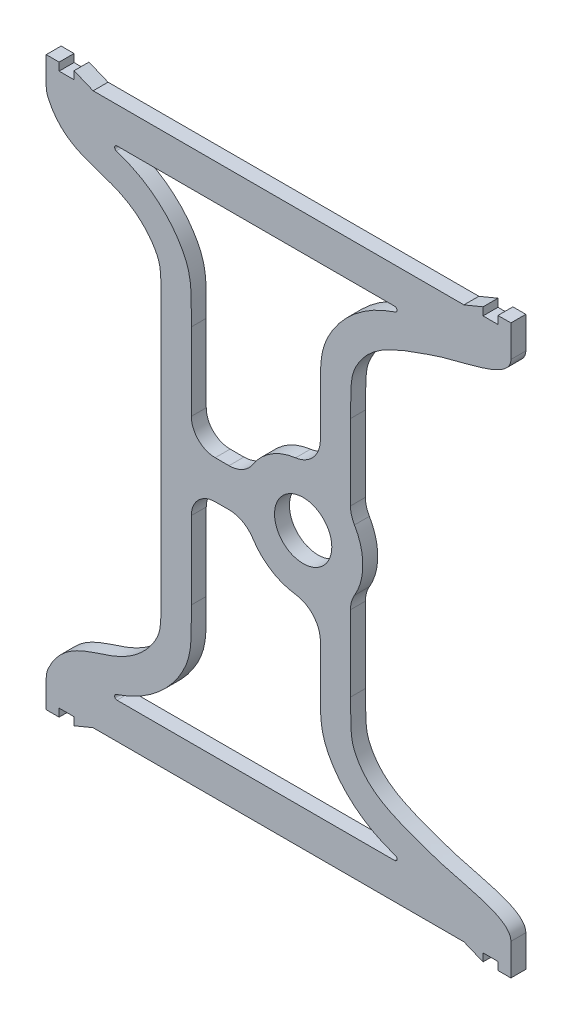
from build123d import *

# Parameters (mm, degrees)
SKETCH1_R           = 3.048
BOSS_EXTRUDE2_DEPTH = 1.5875
FILLET1_R           = 0.254
FILLET2_R           = 2.54


with BuildPart() as part:
    # Sketch1 → Boss-Extrude2 (new body)
    with BuildSketch(Plane.XY):
        with BuildLine():
            Line((-61.413118236, 56.1594), (-63.445118236, 56.995272298))
            Line((-63.445118236, 56.995272298), (-63.445118236, 56.1594))
            Line((-63.445118236, 56.1594), (-65.032618236, 56.1594))
            Line((-65.032618236, 56.1594), (-65.032618236, 56.995272298))
            Line((-65.032618236, 56.995272298), (-66.408583535, 56.995272298))
            Line((-66.408583535, 56.995272298), (-66.408583535, 53.6194))
            add(Edge.make_bspline(
                [(-66.408583535, 53.6194), (-64.924134504, 49.648429222), (-61.093412842, 49.418696243), (-56.357340235, 47.101597924), (-54.056381444, 44.067158287), (-54.218088214, 42.833714309), (-54.167482869, 39.645281186)],
                knots=[0, 0, 0, 0, 0.36456502, 0.416182118, 0.697050608, 1, 1, 1, 1], degree=3))
            Line((-54.167482869, 39.645281186), (-54.167482869, 13.974118814))
            add(Edge.make_bspline(
                [(-66.408583535, 0), (-64.924134504, 3.970970778), (-61.093412842, 4.200703757), (-56.357340235, 6.517802076), (-54.056381444, 9.552241713), (-54.218088214, 10.785685691), (-54.167482869, 13.974118814)],
                knots=[0, 0, 0, 0, 0.36456502, 0.416182118, 0.697050608, 1, 1, 1, 1], degree=3))
            Line((-66.408583535, 0), (-66.408583535, -3.375872298))
            Line((-66.408583535, -3.375872298), (-65.032618236, -3.375872298))
            Line((-65.032618236, -3.375872298), (-65.032618236, -2.54))
            Line((-65.032618236, -2.54), (-63.445118236, -2.54))
            Line((-63.445118236, -2.54), (-63.445118236, -3.375872298))
            Line((-63.445118236, -3.375872298), (-61.413118236, -2.54))
            Line((-61.413118236, -2.54), (-21.954933142, -2.54))
            Line((-21.954933142, -2.54), (-19.922933142, -3.375872298))
            Line((-19.922933142, -3.375872298), (-19.922933142, -2.54))
            Line((-19.922933142, -2.54), (-18.335433142, -2.54))
            Line((-18.335433142, -2.54), (-18.335433142, -3.375872298))
            Line((-18.335433142, -3.375872298), (-16.959467842, -3.375872298))
            Line((-16.959467842, -3.375872298), (-16.959467842, 0))
            add(Edge.make_bspline(
                [(-16.959467842, 0), (-16.958675299, 1.912546448), (-22.34771901, 2.746148332), (-27.970226959, 4.704128909), (-28.3324007, 4.840786662), (-32.040022312, 6.560590351), (-34.043884909, 9.535238573), (-33.977658838, 10.778235575), (-34.028382429, 13.974118814)],
                knots=[0, 0, 0, 0, 0.161069097, 0.19942284, 0.363080258, 0.414817965, 0.696342734, 1, 1, 1, 1], degree=3))
            Line((-34.028382429, 13.974118814), (-34.028382429, 22.02683367))
            ThreePointArc((-34.028382429, 22.02683367), (-33.920729589, 22.825528994), (-33.6054545, 23.567219611))
            ThreePointArc((-33.6054545, 23.567219611), (-32.7152, 26.8097), (-33.6054545, 30.052180389))
            ThreePointArc((-33.6054545, 30.052180389), (-33.920729589, 30.793871006), (-34.028382429, 31.59256633))
            Line((-34.028382429, 31.59256633), (-34.028382429, 39.645281186))
            add(Edge.make_bspline(
                [(-16.959467842, 53.6194), (-16.958675299, 51.706853552), (-22.34771901, 50.873251668), (-27.970226959, 48.915271091), (-28.3324007, 48.778613338), (-32.040022312, 47.058809649), (-34.043884909, 44.084161427), (-33.977658838, 42.841164425), (-34.028382429, 39.645281186)],
                knots=[0, 0, 0, 0, 0.161069097, 0.19942284, 0.363080258, 0.414817965, 0.696342734, 1, 1, 1, 1], degree=3))
            Line((-16.959467842, 53.6194), (-16.959467842, 56.995272298))
            Line((-16.959467842, 56.995272298), (-18.335433142, 56.995272298))
            Line((-18.335433142, 56.995272298), (-18.335433142, 56.1594))
            Line((-18.335433142, 56.1594), (-19.922933142, 56.1594))
            Line((-19.922933142, 56.1594), (-19.922933142, 56.995272298))
            Line((-19.922933142, 56.995272298), (-21.954933142, 56.1594))
            Line((-21.954933142, 56.1594), (-61.413118236, 56.1594))
        make_face()
        with BuildLine():
            Line((-27.775652978, 1.27), (-60.420212319, 1.27))
            add(Edge.make_bspline(
                [(-50.964190334, 13.995349312), (-50.966028907, 13.76903369), (-50.968736252, 13.297769798), (-50.970943536, 12.504225188), (-50.973384126, 11.653006435), (-50.99306064, 10.779703127), (-51.059746569, 9.912816354), (-51.238212475, 8.969633494), (-51.56683397, 8.051039086), (-51.944345594, 7.294831691), (-52.593932882, 6.225598517), (-53.487787779, 5.120067508), (-54.663139999, 4.048582933), (-55.694130166, 3.28929043), (-56.86459295, 2.602546577), (-58.210854848, 2.012002863), (-59.218155496, 1.674229834), (-59.943938178, 1.434141719), (-60.257953494, 1.32747018), (-60.420212319, 1.27)],
                knots=[0.254793571, 0.254793571, 0.254793571, 0.254793571, 0.278081272, 0.301368973, 0.347944374, 0.394519776, 0.441095178, 0.48767058, 0.534245982, 0.580821384, 0.627396785, 0.720547589, 0.767122991, 0.813698393, 0.860273795, 0.906849196, 0.953424598, 0.976712299, 1, 1, 1, 1], degree=3))
            Line((-50.964190334, 13.995349312), (-50.964190334, 22.2377))
            ThreePointArc((-50.964190334, 22.2377), (-50.220241558, 24.033751224), (-48.424190334, 24.7777))
            Line((-48.424190334, 24.7777), (-46.954770627, 24.7777))
            ThreePointArc((-46.954770627, 24.7777), (-45.506465964, 24.407291846), (-44.413829101, 23.387030466))
            ThreePointArc((-44.413829101, 23.387030466), (-42.460247999, 21.443495654), (-39.867288431, 20.510560841))
            ThreePointArc((-39.867288431, 20.510560841), (-37.984519135, 19.511899309), (-37.231674963, 17.518066134))
            Line((-37.231674963, 17.518066134), (-37.231674963, 13.995349312))
            add(Edge.make_bspline(
                [(-27.775652978, 1.27), (-27.937911803, 1.32747018), (-28.25192712, 1.434141719), (-28.977709802, 1.674229834), (-29.985010449, 2.012002863), (-31.331272347, 2.602546577), (-32.501735131, 3.28929043), (-33.532725298, 4.048582933), (-34.708077518, 5.120067508), (-35.601932415, 6.225598517), (-36.251519703, 7.294831691), (-36.629031327, 8.051039086), (-36.957652822, 8.969633494), (-37.136118728, 9.912816354), (-37.202804657, 10.779703127), (-37.222481171, 11.653006435), (-37.224921762, 12.504225188), (-37.227129046, 13.297769798), (-37.22983639, 13.76903369), (-37.231674963, 13.995349312)],
                knots=[0.254793571, 0.254793571, 0.254793571, 0.254793571, 0.278081272, 0.301368973, 0.347944374, 0.394519776, 0.441095178, 0.48767058, 0.534245982, 0.627396785, 0.673972187, 0.720547589, 0.767122991, 0.813698393, 0.860273795, 0.906849196, 0.953424598, 0.976712299, 1, 1, 1, 1], degree=3))
        make_face(mode=Mode.SUBTRACT)
        with BuildLine():
            add(Edge.make_bspline(
                [(-50.964190334, 39.624050688), (-50.966028907, 39.85036631), (-50.968736252, 40.321630202), (-50.970943536, 41.115174812), (-50.973384126, 41.966393565), (-50.99306064, 42.839696873), (-51.059746569, 43.706583646), (-51.238212475, 44.649766506), (-51.56683397, 45.568360914), (-51.944345594, 46.324568309), (-52.593932882, 47.393801483), (-53.487787779, 48.499332492), (-54.663139999, 49.570817067), (-55.694130166, 50.33010957), (-56.86459295, 51.016853423), (-58.210854848, 51.607397137), (-59.218155496, 51.945170166), (-59.943938178, 52.185258281), (-60.257953494, 52.29192982), (-60.420212319, 52.3494)],
                knots=[0.254793571, 0.254793571, 0.254793571, 0.254793571, 0.278081272, 0.301368973, 0.347944374, 0.394519776, 0.441095178, 0.48767058, 0.534245982, 0.580821384, 0.627396785, 0.720547589, 0.767122991, 0.813698393, 0.860273795, 0.906849196, 0.953424598, 0.976712299, 1, 1, 1, 1], degree=3))
            Line((-60.420212319, 52.3494), (-27.775652978, 52.3494))
            add(Edge.make_bspline(
                [(-27.775652978, 52.3494), (-27.937911803, 52.29192982), (-28.25192712, 52.185258281), (-28.977709802, 51.945170166), (-29.985010449, 51.607397137), (-31.331272347, 51.016853423), (-32.501735131, 50.33010957), (-33.532725298, 49.570817067), (-34.708077518, 48.499332492), (-35.601932415, 47.393801483), (-36.251519703, 46.324568309), (-36.629031327, 45.568360914), (-36.957652822, 44.649766506), (-37.136118728, 43.706583646), (-37.202804657, 42.839696873), (-37.222481171, 41.966393565), (-37.224921762, 41.115174812), (-37.227129046, 40.321630202), (-37.22983639, 39.85036631), (-37.231674963, 39.624050688)],
                knots=[0.254793571, 0.254793571, 0.254793571, 0.254793571, 0.278081272, 0.301368973, 0.347944374, 0.394519776, 0.441095178, 0.48767058, 0.534245982, 0.627396785, 0.673972187, 0.720547589, 0.767122991, 0.813698393, 0.860273795, 0.906849196, 0.953424598, 0.976712299, 1, 1, 1, 1], degree=3))
            Line((-37.231674963, 39.624050688), (-37.231674963, 36.101333866))
            ThreePointArc((-37.231674963, 36.101333866), (-37.984519135, 34.107500691), (-39.867288431, 33.108839159))
            ThreePointArc((-39.867288431, 33.108839159), (-42.460247999, 32.175904346), (-44.413829101, 30.232369534))
            ThreePointArc((-44.413829101, 30.232369534), (-45.506465964, 29.212108154), (-46.954770627, 28.8417))
            Line((-46.954770627, 28.8417), (-48.424190334, 28.8417))
            ThreePointArc((-48.424190334, 28.8417), (-50.220241558, 29.585648776), (-50.964190334, 31.3817))
            Line((-50.964190334, 31.3817), (-50.964190334, 39.624050688))
        make_face(mode=Mode.SUBTRACT)
        with Locations((-39.0652, 26.8097)):
            Circle(SKETCH1_R, mode=Mode.SUBTRACT)
    extrude(amount=BOSS_EXTRUDE2_DEPTH)

    # Fillet1
    fillet1_edges = [part.edges().sort_by_distance(p)[0] for p in [
        (-27.775652978, 1.27, 0.79375),
        (-60.420212319, 1.27, 0.79375),
        (-60.420212319, 52.3494, 0.79375),
        (-27.775652978, 52.3494, 0.79375),
    ]]
    fillet(fillet1_edges, radius=FILLET1_R)

    # Fillet2
    fillet2_edges = [part.edges().sort_by_distance(p)[0] for p in [
        (-66.408583535, 0, 0.79375),
        (-66.408583535, 53.6194, 0.79375),
    ]]
    fillet(fillet2_edges, radius=FILLET2_R)


solid = part.part
